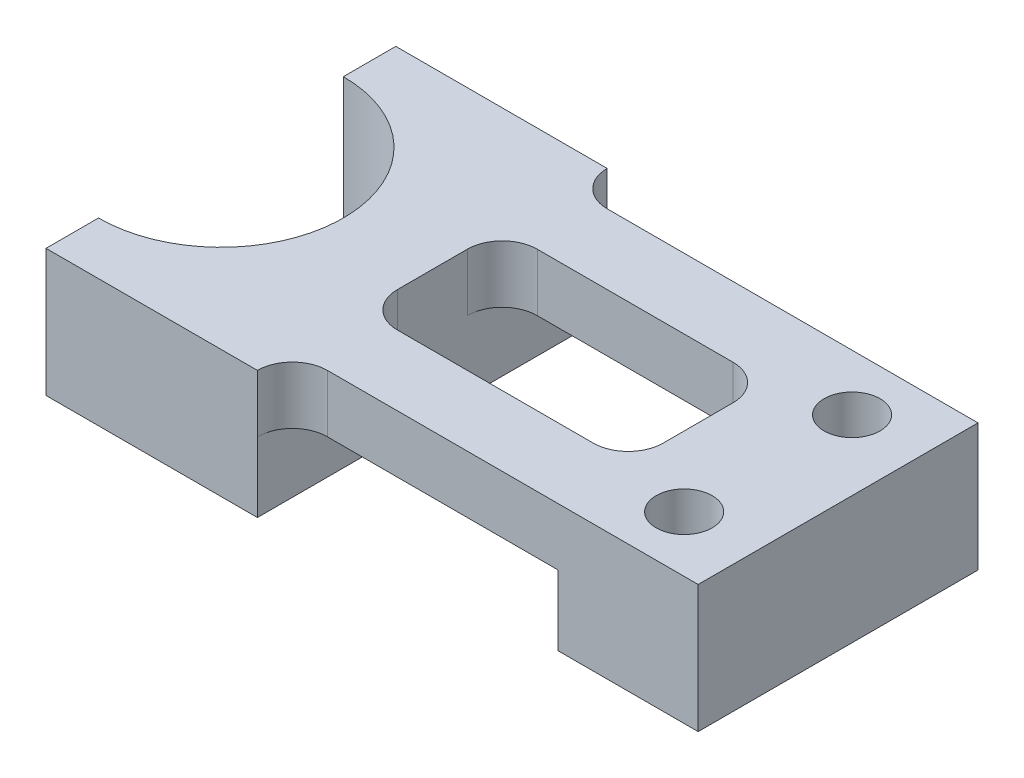
from build123d import *

# Parameters (mm, degrees)
ESQUISSE1_W             = 88.22
ESQUISSE1_H             = 50
BOSS_EXTRU_2_DEPTH      = 18.22
ESQUISSE3_W             = 38
ESQUISSE3_H             = 50
ENL_V_MAT_EXTRU_1_DEPTH = 10
ESQUISSE6_W             = 58
ESQUISSE6_H             = 18.22
ENL_V_MAT_EXTRU_2_DEPTH = 5
ESQUISSE7_W             = 58
ESQUISSE7_H             = 18.22
ENL_V_MAT_EXTRU_3_DEPTH = 5
CONG_6_R                = 5
CONG_11_R               = 5
ESQUISSE8_R             = 17.5
ENL_V_MAT_EXTRU_4_DEPTH = 92.952500984
ESQUISSE10_W            = 38
ESQUISSE10_H            = 20
ENL_V_MAT_EXTRU_5_DEPTH = 92.952500984
CONG_7_R                = 5
CONG_8_R                = 5
CONG_9_R                = 5
CONG_10_R               = 5
ESQUISSE11_R            = 4
ENL_V_MAT_EXTRU_6_DEPTH = 92.952500984


with BuildPart() as part:
    # Esquisse1 → Boss.-Extru.2 (new body)
    with BuildSketch(Plane(origin=(0, 0, 0), x_dir=(1, 0, 0), z_dir=(0, 1, 0))):
        with Locations((20.751905501, -37.579767114)):
            Rectangle(ESQUISSE1_W, ESQUISSE1_H)
    extrude(amount=BOSS_EXTRU_2_DEPTH)

    # Esquisse3 → Enlèv. mat.-Extru.1 (cut)
    with BuildSketch(Plane(origin=(0, 0, 0), x_dir=(-1, 0, 0), z_dir=(0, -1, 0))):
        with Locations((-25.861905501, -37.579767114)):
            Rectangle(ESQUISSE3_W, ESQUISSE3_H)
    extrude(amount=-ENL_V_MAT_EXTRU_1_DEPTH, mode=Mode.SUBTRACT)

    # Esquisse6 → Enlèv. mat.-Extru.2 (cut)
    with BuildSketch(Plane.XY.offset(62.579767114)):
        with Locations((35.861905501, 9.11)):
            Rectangle(ESQUISSE6_W, ESQUISSE6_H)
    extrude(amount=-ENL_V_MAT_EXTRU_2_DEPTH, mode=Mode.SUBTRACT)

    # Esquisse7 → Enlèv. mat.-Extru.3 (cut)
    with BuildSketch(Plane(origin=(0, 0, 12.579767114), x_dir=(-1, 0, 0), z_dir=(0, 0, -1))):
        with Locations((-35.861905501, 9.11)):
            Rectangle(ESQUISSE7_W, ESQUISSE7_H)
    extrude(amount=-ENL_V_MAT_EXTRU_3_DEPTH, mode=Mode.SUBTRACT)

    # Congé6
    cong_6_edges = [part.edges().sort_by_distance(p)[0] for p in [
        (6.861905501, 14.11, 17.579767114),
    ]]
    fillet(cong_6_edges, radius=CONG_6_R - 0.0001)  # a hair under: the kernel refuses the full size

    # Congé11
    cong_11_edges = [part.edges().sort_by_distance(p)[0] for p in [
        (6.861905501, 14.11, 57.579767114),
    ]]
    fillet(cong_11_edges, radius=CONG_11_R - 0.0001)  # a hair under: the kernel refuses the full size

    # Esquisse8 → Enlèv. mat.-Extru.4 (cut, through all)
    with BuildSketch(Plane(origin=(0, 18.22, 0), x_dir=(1, 0, 0), z_dir=(0, 1, 0))):
        with Locations((-23.358094499, -37.579767114)):
            Circle(ESQUISSE8_R)
    extrude(amount=-ENL_V_MAT_EXTRU_4_DEPTH, mode=Mode.SUBTRACT)

    # Esquisse10 → Enlèv. mat.-Extru.5 (cut, through all)
    with BuildSketch(Plane(origin=(0, 18.22, 0), x_dir=(1, 0, 0), z_dir=(0, 1, 0))):
        with Locations((25.861905501, -37.579767114)):
            Rectangle(ESQUISSE10_W, ESQUISSE10_H)
    extrude(amount=-ENL_V_MAT_EXTRU_5_DEPTH, mode=Mode.SUBTRACT)

    # Congé7
    cong_7_edges = [part.edges().sort_by_distance(p)[0] for p in [
        (6.861905501, 14.11, 27.579767114),
    ]]
    fillet(cong_7_edges, radius=CONG_7_R)

    # Congé8
    cong_8_edges = [part.edges().sort_by_distance(p)[0] for p in [
        (6.861905501, 14.11, 47.579767114),
    ]]
    fillet(cong_8_edges, radius=CONG_8_R)

    # Congé9
    cong_9_edges = [part.edges().sort_by_distance(p)[0] for p in [
        (44.861905501, 14.11, 27.579767114),
    ]]
    fillet(cong_9_edges, radius=CONG_9_R)

    # Congé10
    cong_10_edges = [part.edges().sort_by_distance(p)[0] for p in [
        (44.861905501, 14.11, 47.579767114),
    ]]
    fillet(cong_10_edges, radius=CONG_10_R)

    # Esquisse11 → Enlèv. mat.-Extru.6 (cut, through all)
    with BuildSketch(Plane(origin=(0, 18.22, 0), x_dir=(1, 0, 0), z_dir=(0, 1, 0))):
        with Locations(Location((54.861905501, -49.579767114, 0), (0, 0, 270))):
            Circle(ESQUISSE11_R)
        with Locations(Location((54.861905501, -25.579767114, 0), (0, 0, 270))):
            Circle(ESQUISSE11_R)
    extrude(amount=-ENL_V_MAT_EXTRU_6_DEPTH, mode=Mode.SUBTRACT)


solid = part.part
